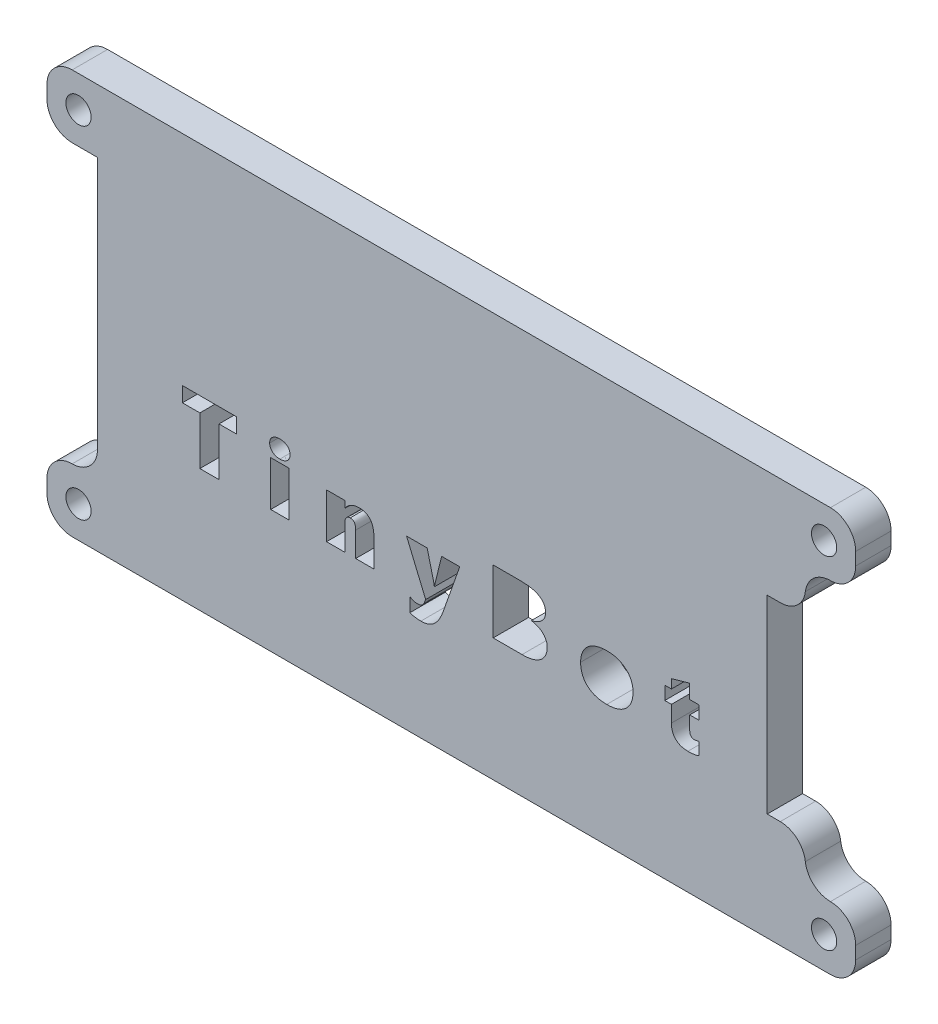
from build123d import *

# Parameters (mm, degrees)
SKETCH1_W           = 56
SKETCH1_H           = 32
BOSS_EXTRUDE1_DEPTH = 2.8
SKETCH2_W           = 3
SKETCH2_H           = 15
CUT_EXTRUDE1_DEPTH  = 33.37035681
SKETCH3_W           = 4
SKETCH3_H           = 5
BOSS_EXTRUDE2_DEPTH = 2.8
SKETCH4_R           = 1
CUT_EXTRUDE2_DEPTH  = 36.886487708
FILLET1_R           = 2
FILLET2_R           = 2
SKETCH5_W           = 1.447368421
SKETCH5_H           = 3.552631579
CUT_EXTRUDE3_DEPTH  = 36.886487849


with BuildPart() as part:
    # Sketch1 → Boss-Extrude1 (new body)
    with BuildSketch(Plane.XY):
        Rectangle(SKETCH1_W, SKETCH1_H)
    extrude(amount=BOSS_EXTRUDE1_DEPTH)

    # Sketch2 → Cut-Extrude1 (cut, through all)
    with BuildSketch(Plane.XY.offset(2.8)):
        with Locations((26.5, 0)):
            Rectangle(SKETCH2_W, SKETCH2_H)
    extrude(amount=-CUT_EXTRUDE1_DEPTH, mode=Mode.SUBTRACT)

    # Sketch3 → Boss-Extrude2 (add)
    with BuildSketch(Plane.XY):
        with Locations((-30, 13.5)):
            Rectangle(SKETCH3_W, SKETCH3_H)
        with Locations((30, 13.5)):
            Rectangle(SKETCH3_W, SKETCH3_H)
        with Locations((30, -13.5)):
            Rectangle(SKETCH3_W, SKETCH3_H)
        with Locations((-30, -13.5)):
            Rectangle(SKETCH3_W, SKETCH3_H)
    extrude(amount=BOSS_EXTRUDE2_DEPTH)

    # Sketch4 → Cut-Extrude2 (cut, through all)
    with BuildSketch(Plane.XY.offset(2.8)):
        with Locations((-29.5, 13.5)):
            Circle(SKETCH4_R)
        with Locations(Location((29.5, 13.5, 0), (0, 0, 180))):
            Circle(SKETCH4_R)
        with Locations((29.5, -13.5)):
            Circle(SKETCH4_R)
        with Locations(Location((-29.5, -13.5, 0), (0, 0, 180))):
            Circle(SKETCH4_R)
    extrude(amount=-CUT_EXTRUDE2_DEPTH, mode=Mode.SUBTRACT)

    # Fillet1
    fillet1_edges = [part.edges().sort_by_distance(p)[0] for p in [
        (32, 16, 1.4),
        (32, 11, 1.4),
        (28, 11, 1.4),
        (28, -11, 1.4),
        (32, -11, 1.4),
        (32, -16, 1.4),
        (-32, -16, 1.4),
        (-28, -11, 1.4),
        (-32, -11, 1.4),
        (-32, 16, 1.4),
        (-32, 11, 1.4),
    ]]
    fillet(fillet1_edges, radius=FILLET1_R - 0.0001)  # a hair under: the kernel refuses the full size

    # Fillet2
    fillet2_edges = [part.edges().sort_by_distance(p)[0] for p in [
        (28, -7.5, 1.4),
        (28, 7.5, 1.4),
    ]]
    fillet(fillet2_edges, radius=FILLET2_R)

    # Sketch5 → Cut-Extrude3 (cut, through all)
    with BuildSketch(Plane.XY.offset(2.8)):
        Polygon((-18.383977688, -2.456244352), (-18.383977688, -6.272033825), (-19.897135583, -6.272033825), (-19.897135583, -2.456244352), (-21.27871453, -2.456244352), (-21.27871453, -1.272033825), (-17.002398741, -1.272033825), (-17.002398741, -2.456244352), align=None)
        with BuildLine():
            add(Edge.make_bspline(
                [(-12.758155319, -1.757231194), (-12.758520874, -1.782640883), (-12.759236178, -1.832361757), (-12.771530888, -1.904893462), (-12.788712348, -1.973761082), (-12.812232867, -2.03969945), (-12.844494449, -2.10103184), (-12.882881422, -2.159381635), (-12.92822263, -2.214027818), (-12.99830648, -2.281023411), (-13.100177394, -2.352197997), (-13.240801118, -2.413612862), (-13.399192773, -2.449572348), (-13.510433289, -2.453964166), (-13.568188214, -2.456244352)],
                knots=[0, 0, 0, 0, 0.760204201, 1.48754351, 2.197064131, 2.885481271, 3.578702709, 4.267655315, 4.974721483, 5.700683323, 7.167228233, 8.670107015, 10.271154005, 12, 12, 12, 12], degree=3))
            add(Edge.make_bspline(
                [(-13.568188214, -2.456244352), (-13.624969315, -2.454186408), (-13.734443563, -2.450218683), (-13.890181111, -2.411019302), (-14.030019413, -2.347799157), (-14.131337519, -2.273803517), (-14.203162018, -2.20621285), (-14.247878724, -2.149872298), (-14.287777914, -2.092379068), (-14.319716822, -2.031238762), (-14.34471138, -1.967127), (-14.361695814, -1.899745794), (-14.374021262, -1.82963694), (-14.374761397, -1.78161572), (-14.375137227, -1.757231194)],
                knots=[0, 0, 0, 0, 1.710747932, 3.298330605, 4.811421064, 6.315260528, 7.061237125, 7.781542997, 8.481367748, 9.170568648, 9.858060719, 10.552824766, 11.265143994, 12, 12, 12, 12], degree=3))
            add(Edge.make_bspline(
                [(-14.375137227, -1.757231194), (-14.374637504, -1.732524706), (-14.373654296, -1.683914544), (-14.363115086, -1.612547154), (-14.345567456, -1.544783394), (-14.322083362, -1.480408535), (-14.291043524, -1.420268415), (-14.252328746, -1.3646178), (-14.207908444, -1.31161881), (-14.139071859, -1.24582227), (-14.038262344, -1.175014231), (-13.89708683, -1.116914111), (-13.738685163, -1.079724728), (-13.62666569, -1.076400664), (-13.568188214, -1.074665404)],
                knots=[0, 0, 0, 0, 0.747873132, 1.471444846, 2.178757828, 2.865049152, 3.542733364, 4.222084308, 4.914391392, 5.633708301, 7.102020019, 8.613275568, 10.232029734, 12, 12, 12, 12], degree=3))
            add(Edge.make_bspline(
                [(-13.568188214, -1.074665404), (-13.510402325, -1.076450291), (-13.399080463, -1.079888793), (-13.241328597, -1.116882689), (-13.099968095, -1.175231914), (-12.998526828, -1.24599039), (-12.928577558, -1.311644914), (-12.882897641, -1.364254031), (-12.84455161, -1.420592952), (-12.812012129, -1.480098555), (-12.788746946, -1.54481499), (-12.771521316, -1.612638186), (-12.759292195, -1.683812405), (-12.758538158, -1.73250768), (-12.758155319, -1.757231194)],
                knots=[0, 0, 0, 0, 1.746027354, 3.36364152, 4.873832775, 6.349625368, 7.075952585, 7.77450211, 8.453374625, 9.135408378, 9.821216385, 10.528031245, 11.252653554, 12, 12, 12, 12], degree=3))
        make_face()
        with Locations((-13.568188215, -4.495718036)):
            Rectangle(SKETCH5_W, SKETCH5_H)
        with BuildLine():
            Line((-7.568188214, -6.272033825), (-7.568188214, -4.326104549))
            add(Edge.make_bspline(
                [(-7.568188214, -4.326104549), (-7.56904971, -4.274621634), (-7.570648134, -4.179099964), (-7.59001102, -4.047579506), (-7.620099711, -3.938296349), (-7.666348154, -3.851368598), (-7.726980742, -3.783747569), (-7.805479967, -3.737553945), (-7.899564163, -3.710976614), (-7.967197125, -3.707882822), (-8.003015517, -3.706244352)],
                knots=[0, 0, 0, 0, 1.419912994, 2.634514022, 3.66097077, 4.532849585, 5.329445907, 6.13564281, 7.012637129, 8, 8, 8, 8], degree=3))
            add(Edge.make_bspline(
                [(-8.003015517, -3.706244352), (-8.034421436, -3.707844554), (-8.094825534, -3.710922279), (-8.180319934, -3.739772745), (-8.25405775, -3.788760635), (-8.315836832, -3.855289642), (-8.363320534, -3.936170722), (-8.399363549, -4.02755315), (-8.419309039, -4.129939943), (-8.422039162, -4.201639755), (-8.423451372, -4.238727904)],
                knots=[0, 0, 0, 0, 0.9871614, 1.898641919, 2.802869758, 3.74990385, 4.732983976, 5.741344421, 6.831665624, 8, 8, 8, 8], degree=3))
            Line((-8.423451372, -4.238727904), (-8.423451372, -6.272033825))
            Line((-8.423451372, -6.272033825), (-9.870819793, -6.272033825))
            Line((-9.870819793, -6.272033825), (-9.870819793, -2.719402246))
            Line((-9.870819793, -2.719402246), (-8.423451372, -2.719402246))
            Line((-8.423451372, -2.719402246), (-8.423451372, -3.245718036))
            Line((-8.423451372, -3.245718036), (-8.410087885, -3.245718036))
            add(Edge.make_bspline(
                [(-8.410087885, -3.245718036), (-8.379046136, -3.200598087), (-8.317464417, -3.11108754), (-8.204514976, -2.993180948), (-8.077373199, -2.890297414), (-7.935277697, -2.805886773), (-7.783308745, -2.7375025), (-7.622840938, -2.689805463), (-7.456355471, -2.658180884), (-7.342868719, -2.655146639), (-7.285499069, -2.653612773)],
                knots=[0, 0, 0, 0, 0.989530383, 1.963065286, 2.941915251, 3.940261913, 4.944883142, 5.94900691, 6.963185115, 8, 8, 8, 8], degree=3))
            add(Edge.make_bspline(
                [(-7.285499069, -2.653612773), (-7.238517412, -2.654944944), (-7.147001265, -2.657539897), (-7.01423457, -2.673331383), (-6.890681562, -2.702593605), (-6.776234505, -2.742110751), (-6.671073669, -2.794235047), (-6.574862404, -2.857456402), (-6.486480961, -2.931408642), (-6.40954984, -3.018869797), (-6.340927547, -3.116742693), (-6.281109887, -3.22582649), (-6.232609697, -3.347051748), (-6.190894166, -3.47847759), (-6.159513812, -3.621656294), (-6.137549261, -3.776637917), (-6.122433766, -3.942720658), (-6.12136781, -4.0574284), (-6.120819793, -4.116400602)],
                knots=[0, 0, 0, 0, 1.055405868, 2.055838014, 2.996710558, 3.902197639, 4.76956244, 5.625550458, 6.482886789, 7.34956841, 8.233539694, 9.163488977, 10.1367914, 11.161557985, 12.257627818, 13.424425727, 14.675875896, 16, 16, 16, 16], degree=3))
            Line((-6.120819793, -4.116400602), (-6.120819793, -6.272033825))
            Line((-6.120819793, -6.272033825), (-7.568188214, -6.272033825))
        make_face()
        with BuildLine():
            add(Edge.make_bspline(
                [(-2.411115846, -7.982560141), (-2.482451226, -7.980505515), (-2.631052797, -7.976225441), (-2.817594152, -7.95390829), (-2.968823186, -7.927362662), (-3.07768832, -7.902221455), (-3.181150683, -7.875527083), (-3.246654238, -7.852145536), (-3.27871453, -7.840701589)],
                knots=[0, 0, 0, 0, 1.454157979, 3.029214367, 3.823865193, 4.582973609, 5.306445579, 6, 6, 6, 6], degree=3))
            Line((-3.27871453, -7.840701589), (-3.27871453, -6.732560141))
            add(Edge.make_bspline(
                [(-3.27871453, -6.732560141), (-3.262498753, -6.744890254), (-3.227931071, -6.771174742), (-3.167818029, -6.805731966), (-3.097351119, -6.838174553), (-3.019101135, -6.86976322), (-2.936144552, -6.895371276), (-2.853550985, -6.915609213), (-2.772942242, -6.927157579), (-2.719879534, -6.929015565), (-2.693804991, -6.929928562)],
                knots=[0, 0, 0, 0, 0.77933831, 1.661339992, 2.647273304, 3.748408628, 4.889458594, 5.968170977, 7.00157724, 8, 8, 8, 8], degree=3))
            add(Edge.make_bspline(
                [(-2.693804991, -6.929928562), (-2.660498462, -6.929040219), (-2.596580523, -6.927335415), (-2.505351975, -6.911706831), (-2.422515138, -6.886407711), (-2.349138353, -6.848618554), (-2.283145961, -6.802396922), (-2.226771444, -6.744359276), (-2.179052066, -6.676320128), (-2.155732148, -6.625054893), (-2.143846109, -6.598925273)],
                knots=[0, 0, 0, 0, 1.164190832, 2.234176973, 3.227357369, 4.181510529, 5.109481965, 6.033341648, 6.997604628, 8, 8, 8, 8], degree=3))
            Line((-2.143846109, -6.598925273), (-2.02871453, -6.316236128))
            Line((-2.02871453, -6.316236128), (-3.541872425, -2.719402246))
            Line((-3.541872425, -2.719402246), (-1.910499069, -2.719402246))
            Line((-1.910499069, -2.719402246), (-1.48183953, -4.440208168))
            add(Edge.make_bspline(
                [(-1.48183953, -4.440208168), (-1.471827285, -4.478565048), (-1.452726579, -4.551739794), (-1.426552111, -4.656841512), (-1.405840083, -4.752796393), (-1.385066212, -4.838328085), (-1.371765002, -4.914837245), (-1.358575572, -4.980685808), (-1.349961385, -5.037266069), (-1.347338819, -5.072042372), (-1.346148741, -5.087823299)],
                knots=[0, 0, 0, 0, 1.436392107, 2.740254895, 3.923966114, 4.993212921, 5.928256675, 6.736694734, 7.426732366, 8, 8, 8, 8], degree=3))
            Line((-1.346148741, -5.087823299), (-1.332785254, -5.087823299))
            add(Edge.make_bspline(
                [(-1.332785254, -5.087823299), (-1.328828777, -5.060729459), (-1.320492337, -5.003641765), (-1.308886597, -4.940330183), (-1.298777293, -4.892111751), (-1.290627515, -4.856795222), (-1.277979334, -4.805814956), (-1.261427804, -4.739448329), (-1.242413053, -4.656576645), (-1.217063007, -4.558568791), (-1.189928346, -4.444228876), (-1.157476574, -4.314932567), (-1.123333345, -4.169624419), (-1.082258007, -4.009330834), (-1.039761722, -3.832612802), (-0.992381283, -3.640407141), (-0.940474006, -3.432625797), (-0.886878106, -3.208486821), (-0.826486253, -2.96933068), (-0.786144168, -2.804407157), (-0.765351043, -2.719402246)],
                knots=[0, 0, 0, 0, 0.606968061, 1.278903521, 1.426391309, 1.69910808, 2.082311416, 2.590790227, 3.215374228, 3.967033623, 4.834775673, 5.820414365, 6.922149733, 8.14359625, 9.48849722, 10.951295797, 12.531995584, 14.23616119, 16.060041535, 18, 18, 18, 18], degree=3))
            Line((-0.765351043, -2.719402246), (0.668653891, -2.719402246))
            Line((0.668653891, -2.719402246), (-0.628632293, -6.401556852))
            add(Edge.make_bspline(
                [(-0.628632293, -6.401556852), (-0.652924645, -6.470021091), (-0.700120684, -6.60303583), (-0.78073876, -6.792168782), (-0.864924185, -6.966570934), (-0.953321984, -7.126251553), (-1.045132842, -7.271440509), (-1.1423288, -7.401120498), (-1.244193975, -7.515574097), (-1.350652831, -7.616237579), (-1.462428054, -7.703522321), (-1.580721023, -7.777556764), (-1.703779529, -7.841741986), (-1.833672913, -7.893496128), (-1.969353061, -7.933215333), (-2.111263133, -7.96252842), (-2.259294707, -7.978534041), (-2.360025191, -7.981205283), (-2.411115846, -7.982560141)],
                knots=[0, 0, 0, 0, 1.354611913, 2.631787804, 3.832231353, 4.965040332, 6.034041789, 7.03354406, 7.984058843, 8.888243272, 9.76262204, 10.624297294, 11.487487916, 12.347858768, 13.227476522, 14.121097554, 15.047017821, 16, 16, 16, 16], degree=3))
        make_face()
        with BuildLine():
            add(Edge.make_bspline(
                [(7.589706523, -4.73831672), (7.588100688, -4.79801078), (7.584977239, -4.914119496), (7.561494252, -5.083220301), (7.520018278, -5.241310988), (7.463310168, -5.389294461), (7.391264263, -5.527753521), (7.300685012, -5.65438832), (7.195470868, -5.771732273), (7.073156181, -5.876339571), (6.936896393, -5.970337109), (6.786268253, -6.051657481), (6.621212983, -6.119119079), (6.44333024, -6.176025958), (6.250804677, -6.218260315), (6.045245421, -6.250373096), (5.825373464, -6.268672003), (5.674306706, -6.27089087), (5.596491062, -6.272033825)],
                knots=[0, 0, 0, 0, 1.004941836, 1.954675336, 2.867066985, 3.751014925, 4.618139792, 5.487354235, 6.365616591, 7.265500201, 8.190500647, 9.148243911, 10.141474893, 11.188813727, 12.288946431, 13.456611836, 14.689881289, 16, 16, 16, 16], degree=3))
            Line((5.596491062, -6.272033825), (3.313390733, -6.272033825))
            Line((3.313390733, -6.272033825), (3.313390733, -1.272033825))
            Line((3.313390733, -1.272033825), (5.452576588, -1.272033825))
            add(Edge.make_bspline(
                [(5.452576588, -1.272033825), (5.53345982, -1.273148623), (5.690199305, -1.275308932), (5.917684654, -1.288245526), (6.129869334, -1.311342835), (6.326017846, -1.345574809), (6.507147918, -1.386628388), (6.671739503, -1.439645703), (6.821973517, -1.499070555), (6.955489496, -1.571001458), (7.074911252, -1.650468968), (7.177193976, -1.741531281), (7.26399079, -1.841691028), (7.335727025, -1.950968394), (7.38996415, -2.070935488), (7.43103648, -2.199003274), (7.453120186, -2.337614743), (7.456425098, -2.432872634), (7.458127575, -2.481943365)],
                knots=[0, 0, 0, 0, 1.470450343, 2.849510666, 4.140724945, 5.348153687, 6.467804259, 7.513904173, 8.489066975, 9.40038108, 10.265988166, 11.091109087, 11.881644404, 12.6695246, 13.458315427, 14.268055653, 15.107813799, 16, 16, 16, 16], degree=3))
            add(Edge.make_bspline(
                [(7.458127575, -2.481943365), (7.45659422, -2.524555607), (7.453562824, -2.608798698), (7.427912761, -2.732317903), (7.38656103, -2.850605319), (7.328464595, -2.963393683), (7.253822084, -3.069894959), (7.161933149, -3.169787555), (7.052304128, -3.261854306), (6.927738221, -3.346174268), (6.791708325, -3.420698124), (6.647612609, -3.48339641), (6.496678379, -3.533772225), (6.392395744, -3.555475868), (6.339706523, -3.56644172)],
                knots=[0, 0, 0, 0, 0.905563296, 1.790270789, 2.670735777, 3.563808354, 4.479664958, 5.428756466, 6.442150824, 7.517511869, 8.623190602, 9.736122905, 10.856166973, 12, 12, 12, 12], degree=3))
            Line((6.339706523, -3.56644172), (6.339706523, -3.579805207))
            add(Edge.make_bspline(
                [(6.339706523, -3.579805207), (6.398906667, -3.588066925), (6.515134419, -3.60428717), (6.682866435, -3.651163114), (6.841993255, -3.710867812), (6.989433463, -3.788622332), (7.124955191, -3.877133273), (7.245588823, -3.977334194), (7.34918221, -4.089043338), (7.435073566, -4.210397376), (7.504911537, -4.3372773), (7.55277417, -4.469188929), (7.584923918, -4.602796243), (7.588115998, -4.693247423), (7.589706523, -4.73831672)],
                knots=[0, 0, 0, 0, 1.154938219, 2.267492353, 3.360469693, 4.436517578, 5.484272844, 6.486430989, 7.461914609, 8.421875189, 9.355978566, 10.253462415, 11.129749106, 12, 12, 12, 12], degree=3))
        make_face()
        with BuildLine():
            add(Edge.make_bspline(
                [(14.379180207, -4.434040404), (14.377746314, -4.506075466), (14.374943948, -4.646859016), (14.348862921, -4.852030501), (14.305796831, -5.045114215), (14.246195929, -5.226565462), (14.168747608, -5.396272415), (14.073757631, -5.554084206), (13.962115884, -5.70035116), (13.832916226, -5.832886217), (13.689291487, -5.952439604), (13.530577459, -6.055433063), (13.358999258, -6.143772828), (13.172649721, -6.213680016), (12.973927688, -6.271226802), (12.760955805, -6.308963448), (12.534900817, -6.333295424), (12.379521854, -6.336285573), (12.299616062, -6.337823299)],
                knots=[0, 0, 0, 0, 1.081099096, 2.11287345, 3.09883392, 4.047253469, 4.97496563, 5.893388681, 6.807073837, 7.731141704, 8.666453591, 9.606746242, 10.566152034, 11.557839902, 12.590229658, 13.667847103, 14.800657942, 16, 16, 16, 16], degree=3))
            add(Edge.make_bspline(
                [(12.299616062, -6.337823299), (12.220414628, -6.336126193), (12.066134347, -6.33282032), (11.841555568, -6.310627155), (11.630480922, -6.271431389), (11.433025958, -6.217203407), (11.248108689, -6.148338261), (11.077081181, -6.063043451), (10.919585869, -5.961617076), (10.776631126, -5.845333727), (10.648460427, -5.715822602), (10.538118353, -5.572800454), (10.443674186, -5.418528972), (10.366726721, -5.252574613), (10.306268827, -5.07484377), (10.265259358, -4.885109895), (10.238546061, -4.683909574), (10.2358324, -4.545834804), (10.234443365, -4.475158825)],
                knots=[0, 0, 0, 0, 1.205356207, 2.347971284, 3.430103075, 4.468804349, 5.460630163, 6.428476115, 7.371603028, 8.305777514, 9.22767377, 10.138306425, 11.048774816, 11.974997243, 12.916637995, 13.899705916, 14.924927858, 16, 16, 16, 16], degree=3))
            add(Edge.make_bspline(
                [(10.234443365, -4.475158825), (10.235173376, -4.429210182), (10.236608879, -4.338856202), (10.249728235, -4.205734337), (10.268588179, -4.077173766), (10.296646047, -3.953205248), (10.332303048, -3.833841478), (10.377115335, -3.719422575), (10.428128519, -3.609090604), (10.487926093, -3.503845419), (10.556188929, -3.404508821), (10.629639493, -3.309798209), (10.710790139, -3.2214581), (10.799057454, -3.139656155), (10.893870509, -3.063406452), (10.995067427, -2.993104727), (11.103343214, -2.929299623), (11.218303147, -2.87214464), (11.338828032, -2.820844131), (11.463772224, -2.775070031), (11.594122663, -2.739169337), (11.727439431, -2.706126495), (11.866053912, -2.683331585), (12.008666754, -2.665589002), (12.156228826, -2.65511038), (12.256082729, -2.654117293), (12.306811786, -2.653612773)],
                knots=[0, 0, 0, 0, 1.062151441, 2.088627704, 3.090374916, 4.064900734, 5.024889293, 5.968022775, 6.903772644, 7.833431619, 8.762989304, 9.688588023, 10.602619076, 11.533222895, 12.468670839, 13.413732546, 14.379848199, 15.371961488, 16.380049034, 17.407594941, 18.445837143, 19.504703434, 20.581907454, 21.69140676, 22.827158952, 24, 24, 24, 24], degree=3))
            add(Edge.make_bspline(
                [(12.306811786, -2.653612773), (12.358922125, -2.653991574), (12.461901523, -2.654740153), (12.613434018, -2.667070872), (12.760163036, -2.683510586), (12.900635585, -2.709928687), (13.036538174, -2.74119156), (13.166328014, -2.781729593), (13.291818607, -2.827452414), (13.410322934, -2.882492027), (13.523929384, -2.941877696), (13.631090435, -3.007383864), (13.730388836, -3.080105302), (13.825282723, -3.1556339), (13.910778028, -3.239311825), (13.990873895, -3.327174107), (14.064060425, -3.420765432), (14.129509354, -3.520429275), (14.187654636, -3.624084733), (14.239958068, -3.730371294), (14.282728853, -3.840216976), (14.31792209, -3.953264342), (14.345656807, -4.068958278), (14.365332388, -4.188143108), (14.376550404, -4.310124857), (14.378299827, -4.392557184), (14.379180207, -4.434040404)],
                knots=[0, 0, 0, 0, 1.221889948, 2.414674184, 3.564103954, 4.683381079, 5.765330591, 6.833097081, 7.870672372, 8.895689131, 9.895147831, 10.876606193, 11.838016058, 12.780699331, 13.718573665, 14.640365487, 15.568025095, 16.50203445, 17.434139959, 18.3543537, 19.278210478, 20.195893644, 21.129660908, 22.066467067, 23.026969449, 24, 24, 24, 24], degree=3))
        make_face()
        with BuildLine():
            add(Edge.make_bspline(
                [(19.589706523, -6.207272312), (19.570655758, -6.215524592), (19.527913614, -6.234039341), (19.453554735, -6.255453521), (19.363889546, -6.276537115), (19.259664584, -6.29886882), (19.141461874, -6.315182134), (19.010919742, -6.329331213), (18.86882102, -6.335542611), (18.770081643, -6.337045936), (18.719023957, -6.337823299)],
                knots=[0, 0, 0, 0, 0.562124598, 1.26117827, 2.092199002, 3.059163164, 4.147762268, 5.323919711, 6.616210982, 8, 8, 8, 8], degree=3))
            add(Edge.make_bspline(
                [(18.719023957, -6.337823299), (18.669648742, -6.33683801), (18.573046232, -6.334910295), (18.43224172, -6.319856232), (18.300090098, -6.29254781), (18.175421404, -6.257165413), (18.059648006, -6.209588501), (17.951208963, -6.153098608), (17.852257577, -6.084582896), (17.761265922, -6.006344484), (17.680171885, -5.918028271), (17.609787587, -5.820755459), (17.550450758, -5.714487252), (17.502931819, -5.59935241), (17.463922554, -5.475718492), (17.438331291, -5.34291308), (17.421079913, -5.201695655), (17.419476081, -5.104668582), (17.418653891, -5.054928562)],
                knots=[0, 0, 0, 0, 1.141123596, 2.232606074, 3.267028828, 4.256990919, 5.223226378, 6.154961112, 7.077597284, 7.998464257, 8.923307167, 9.842128525, 10.767513825, 11.729455461, 12.716403479, 13.758588628, 14.850961444, 16, 16, 16, 16], degree=3))
            Line((17.418653891, -5.054928562), (17.418653891, -3.772033825))
            Line((17.418653891, -3.772033825), (16.892338102, -3.772033825))
            Line((16.892338102, -3.772033825), (16.892338102, -2.719402246))
            Line((16.892338102, -2.719402246), (17.418653891, -2.719402246))
            Line((17.418653891, -2.719402246), (17.418653891, -2.010109483))
            Line((17.418653891, -2.010109483), (18.866022312, -1.600981194))
            Line((18.866022312, -1.600981194), (18.866022312, -2.719402246))
            Line((18.866022312, -2.719402246), (19.589706523, -2.719402246))
            Line((19.589706523, -2.719402246), (19.589706523, -3.772033825))
            Line((19.589706523, -3.772033825), (18.866022312, -3.772033825))
            Line((18.866022312, -3.772033825), (18.866022312, -4.822609483))
            add(Edge.make_bspline(
                [(18.866022312, -4.822609483), (18.867285028, -4.858643336), (18.8696689, -4.926671424), (18.885017597, -5.02193712), (18.913675469, -5.103099111), (18.954590054, -5.169409101), (19.005678785, -5.223444277), (19.071032092, -5.259621443), (19.146950009, -5.281722879), (19.201314002, -5.28399574), (19.229920338, -5.28519172)],
                knots=[0, 0, 0, 0, 1.288056299, 2.431713562, 3.435164107, 4.342616441, 5.200009575, 6.06132992, 6.979871696, 8, 8, 8, 8], degree=3))
            add(Edge.make_bspline(
                [(19.229920338, -5.28519172), (19.25874798, -5.284385102), (19.317341839, -5.282745603), (19.406354994, -5.269510647), (19.497903552, -5.24934065), (19.558671923, -5.229523121), (19.589706523, -5.219402246)],
                knots=[0, 0, 0, 0, 0.941298585, 1.913244174, 2.934287195, 4, 4, 4, 4], degree=3))
            Line((19.589706523, -5.219402246), (19.589706523, -6.207272312))
        make_face()
    extrude(amount=-CUT_EXTRUDE3_DEPTH, mode=Mode.SUBTRACT)


solid = part.part
